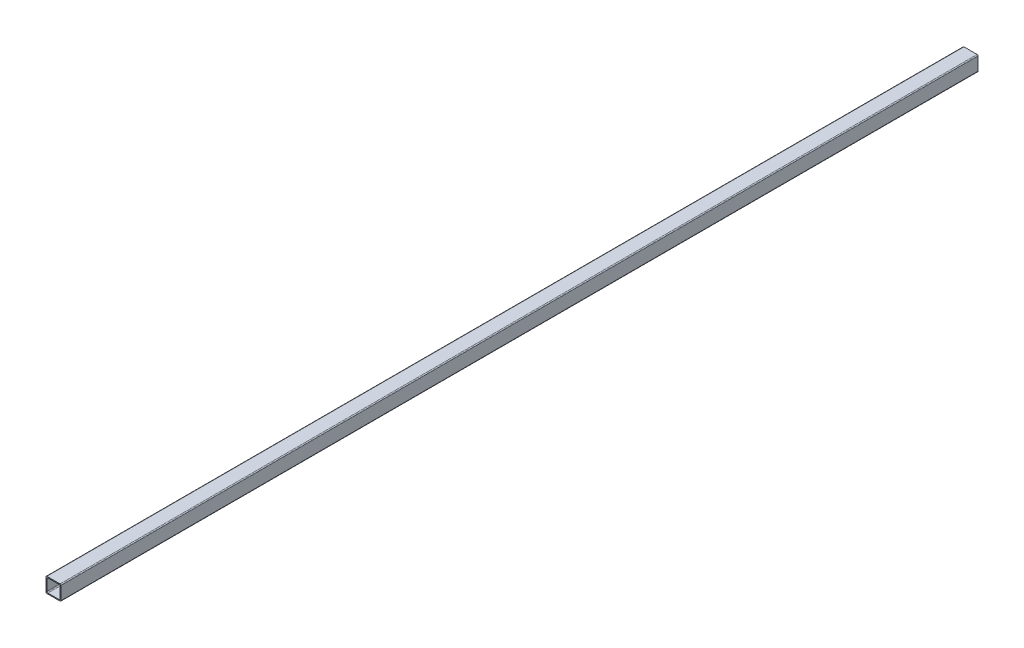
from build123d import *

# Parameters (mm, degrees)
SKETCH1_W           = 8
SKETCH1_H           = 8
SKETCH1_W_2         = 7
SKETCH1_H_2         = 7
BOSS_EXTRUDE1_DEPTH = 490
FILLET1_R           = 0.5


with BuildPart() as part:
    # Sketch1 → Boss-Extrude1 (new body)
    with BuildSketch(Plane.XY):
        Rectangle(SKETCH1_W, SKETCH1_H)
        Rectangle(SKETCH1_W_2, SKETCH1_H_2, mode=Mode.SUBTRACT)
    extrude(amount=BOSS_EXTRUDE1_DEPTH)

    # Fillet1
    fillet1_edges = [part.edges().sort_by_distance(p)[0] for p in [
        (4, 4, 245),
        (3.5, 3.5, 245),
        (4, -4, 245),
        (3.5, -3.5, 245),
        (-3.5, -3.5, 245),
        (-4, -4, 245),
        (-4, 4, 245),
        (-3.5, 3.5, 245),
    ]]
    fillet(fillet1_edges, radius=FILLET1_R)


solid = part.part
